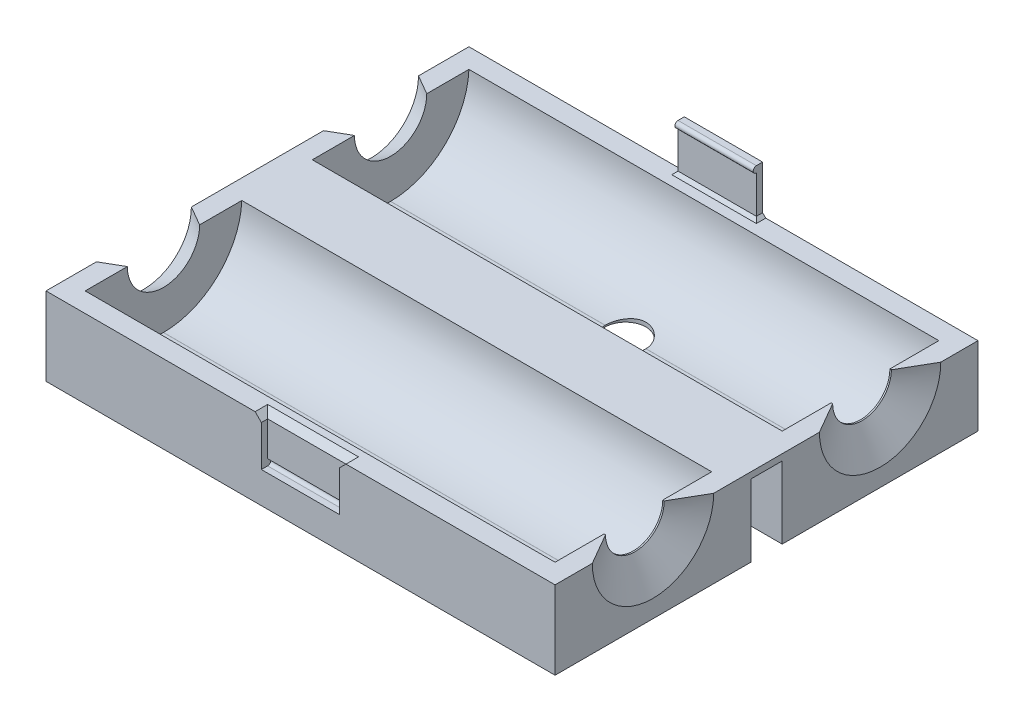
from build123d import *

# Parameters (mm, degrees)
BOSS_EXTRUDE1_DEPTH  = 6.35
BOSS_EXTRUDE2_START  = -6.096
SKETCH1_3_W          = 38.1
SKETCH1_3_H          = 12.7
BOSS_EXTRUDE2_DEPTH  = 1.5875
SKETCH1_5_W          = 41.275
SKETCH1_5_H          = 1.27
BOSS_EXTRUDE4_DEPTH  = 0.508
CHAMFER2_SIZE        = 1.524
SKETCH5_R            = 2.38125
CUT_EXTRUDE1_DEPTH   = 47.505502938
CHAMFER3_SIZE        = 1.466469684
CHAMFER3_SIZE_2      = 2.54
SKETCH6_W            = 6.35
SKETCH6_H            = 0.508
BOSS_EXTRUDE7_DEPTH  = 3.81
BOSS_EXTRUDE10_DEPTH = 6.35
SKETCH6_5_W          = 6.35
SKETCH6_5_H          = 0.508
CUT_EXTRUDE2_DEPTH   = 3.81
CUT_EXTRUDE3_DEPTH   = 6.35
CHAMFER4_SIZE        = 0.508
CHAMFER5_SIZE        = 0.254
SKETCH10_R           = 1.651
CUT_EXTRUDE4_DEPTH   = 46.905317826
CHAMFER6_SIZE        = 2.54
CHAMFER6_SIZE2       = 1.466469684
FILLET1_R            = 6.35


with BuildPart() as part:
    # Sketch1 → Boss-Extrude1 (new body)
    with BuildSketch(Plane(origin=(0, 0, 0), x_dir=(1, 0, 0), z_dir=(0, 1, 0))):
        Polygon((-1.5875, 6.35), (-1.5875, -1.5875), (39.6875, -1.5875), (39.6875, 6.35), (38.1, 6.35), (38.1, 0), (0, 0), (0, 6.35), align=None)
        Polygon((39.6875, -4.1275), (-1.5875, -4.1275), (-1.5875, -12.065), (0, -12.065), (0, -5.715), (38.1, -5.715), (38.1, -12.065), (39.6875, -12.065), align=None)
        Polygon((0, -12.065), (-1.5875, -12.065), (-1.5875, -20.0025), (39.6875, -20.0025), (39.6875, -12.065), (38.1, -12.065), (38.1, -18.415), (0, -18.415), align=None)
        Polygon((-1.5875, 14.2875), (-1.5875, 6.35), (0, 6.35), (0, 12.7), (38.1, 12.7), (38.1, 6.35), (39.6875, 6.35), (39.6875, 14.2875), align=None)
    extrude(amount=-BOSS_EXTRUDE1_DEPTH)

    # Sketch1<3> → Boss-Extrude2 (add)
    with BuildSketch(Plane(origin=(0, 0, 0), x_dir=(1, 0, 0), z_dir=(0, 1, 0)).offset(BOSS_EXTRUDE2_START)):
        with Locations((19.05, -12.065)):
            Rectangle(SKETCH1_3_W, SKETCH1_3_H)
        with Locations((19.05, 6.35)):
            Rectangle(SKETCH1_3_W, SKETCH1_3_H)
    extrude(amount=-BOSS_EXTRUDE2_DEPTH)

    # Sketch1<5> → Boss-Extrude4 (add)
    with BuildSketch(Plane(origin=(0, 0, 0), x_dir=(1, 0, 0), z_dir=(0, 1, 0))):
        with Locations((19.05, -2.2225)):
            Rectangle(SKETCH1_5_W, SKETCH1_5_H)
        with Locations((19.05, -3.4925)):
            Rectangle(SKETCH1_5_W, SKETCH1_5_H)
    extrude(amount=-BOSS_EXTRUDE4_DEPTH)

    # Chamfer2
    # the kernel refuses this chamfer: 1.524 mm, written as the material it adds along each edge
    with BuildSketch(Plane(origin=(38.1, -6.35, 18.415), x_dir=(0, 0, 1), z_dir=(-1, 0, 0))) as chamfer2_piece_1_section:
        Polygon((CHAMFER2_SIZE, 0), (0, -CHAMFER2_SIZE), (0, 0), align=None)
    chamfer2_piece_1 = extrude(amount=38.1, mode=Mode.PRIVATE)
    chamfer2_piece_1 = split(chamfer2_piece_1, bisect_by=Plane(origin=(38.1, -7.6835, 18.415), z_dir=(0, 1, 0)), keep=Keep.TOP, mode=Mode.PRIVATE)
    add(chamfer2_piece_1)
    with BuildSketch(Plane(origin=(0, -6.35, 5.715), x_dir=(-1, 0, 0), z_dir=(0, 0, 1))) as chamfer2_piece_2_section:
        Polygon((CHAMFER2_SIZE, 0), (0, CHAMFER2_SIZE), (0, 0), align=None)
    chamfer2_piece_2 = extrude(amount=12.7, mode=Mode.PRIVATE)
    chamfer2_piece_2 = split(chamfer2_piece_2, bisect_by=Plane(origin=(0, -7.6835, 5.715), z_dir=(0, 1, 0)), keep=Keep.TOP, mode=Mode.PRIVATE)
    add(chamfer2_piece_2)
    with BuildSketch(Plane(origin=(38.1, -6.35, 18.415), x_dir=(1, 0, 0), z_dir=(0, 0, -1))) as chamfer2_piece_3_section:
        Polygon((CHAMFER2_SIZE, 0), (0, CHAMFER2_SIZE), (0, 0), align=None)
    chamfer2_piece_3 = extrude(amount=12.7, mode=Mode.PRIVATE)
    chamfer2_piece_3 = split(chamfer2_piece_3, bisect_by=Plane(origin=(38.1, -7.6835, 18.415), z_dir=(0, 1, 0)), keep=Keep.TOP, mode=Mode.PRIVATE)
    add(chamfer2_piece_3)
    with BuildSketch(Plane(origin=(0, -6.35, 5.715), x_dir=(0, 0, -1), z_dir=(1, 0, 0))) as chamfer2_piece_4_section:
        Polygon((CHAMFER2_SIZE, 0), (0, -CHAMFER2_SIZE), (0, 0), align=None)
    chamfer2_piece_4 = extrude(amount=38.1, mode=Mode.PRIVATE)
    chamfer2_piece_4 = split(chamfer2_piece_4, bisect_by=Plane(origin=(0, -7.6835, 5.715), z_dir=(0, 1, 0)), keep=Keep.TOP, mode=Mode.PRIVATE)
    add(chamfer2_piece_4)
    with BuildSketch(Plane(origin=(38.1, -6.35, 0), x_dir=(0, 0, 1), z_dir=(-1, 0, 0))) as chamfer2_piece_5_section:
        Polygon((CHAMFER2_SIZE, 0), (0, -CHAMFER2_SIZE), (0, 0), align=None)
    chamfer2_piece_5 = extrude(amount=38.1, mode=Mode.PRIVATE)
    chamfer2_piece_5 = split(chamfer2_piece_5, bisect_by=Plane(origin=(38.1, -7.6835, 0), z_dir=(0, 1, 0)), keep=Keep.TOP, mode=Mode.PRIVATE)
    add(chamfer2_piece_5)
    with BuildSketch(Plane(origin=(38.1, -6.35, 0), x_dir=(1, 0, 0), z_dir=(0, 0, -1))) as chamfer2_piece_6_section:
        Polygon((CHAMFER2_SIZE, 0), (0, CHAMFER2_SIZE), (0, 0), align=None)
    chamfer2_piece_6 = extrude(amount=12.7, mode=Mode.PRIVATE)
    chamfer2_piece_6 = split(chamfer2_piece_6, bisect_by=Plane(origin=(38.1, -7.6835, 0), z_dir=(0, 1, 0)), keep=Keep.TOP, mode=Mode.PRIVATE)
    add(chamfer2_piece_6)
    with BuildSketch(Plane(origin=(0, -6.35, -12.7), x_dir=(-1, 0, 0), z_dir=(0, 0, 1))) as chamfer2_piece_7_section:
        Polygon((CHAMFER2_SIZE, 0), (0, CHAMFER2_SIZE), (0, 0), align=None)
    chamfer2_piece_7 = extrude(amount=12.7, mode=Mode.PRIVATE)
    chamfer2_piece_7 = split(chamfer2_piece_7, bisect_by=Plane(origin=(0, -7.6835, -12.7), z_dir=(0, 1, 0)), keep=Keep.TOP, mode=Mode.PRIVATE)
    add(chamfer2_piece_7)
    with BuildSketch(Plane(origin=(0, -6.35, -12.7), x_dir=(0, 0, -1), z_dir=(1, 0, 0))) as chamfer2_piece_8_section:
        Polygon((CHAMFER2_SIZE, 0), (0, -CHAMFER2_SIZE), (0, 0), align=None)
    chamfer2_piece_8 = extrude(amount=38.1, mode=Mode.PRIVATE)
    chamfer2_piece_8 = split(chamfer2_piece_8, bisect_by=Plane(origin=(0, -7.6835, -12.7), z_dir=(0, 1, 0)), keep=Keep.TOP, mode=Mode.PRIVATE)
    add(chamfer2_piece_8)
    with BuildSketch(Plane(origin=(38.1, -6.35, 22.334244874), x_dir=(1, 0, 0), z_dir=(0, 0, -1))) as chamfer2_piece_9a_section:
        Polygon((CHAMFER2_SIZE, 0), (0, CHAMFER2_SIZE), (0, 0), align=None)
    chamfer2_piece_9a = extrude(amount=16.619244874, mode=Mode.PRIVATE)
    chamfer2_piece_9a = split(chamfer2_piece_9a, bisect_by=Plane(origin=(38.1, -6.35, 20.0025), z_dir=(0, 0, -1)), keep=Keep.TOP, mode=Mode.PRIVATE)
    chamfer2_piece_9a = split(chamfer2_piece_9a, bisect_by=Plane(origin=(38.1, -6.35, 18.415), z_dir=(0, 0, 1)), keep=Keep.TOP, mode=Mode.PRIVATE)
    chamfer2_piece_9a = split(chamfer2_piece_9a, bisect_by=Plane(origin=(38.1, -7.6835, 22.334244874), z_dir=(0, 1, 0)), keep=Keep.TOP, mode=Mode.PRIVATE)
    with BuildSketch(Plane(origin=(42.019244874, -6.35, 18.415), x_dir=(0, 0, 1), z_dir=(-1, 0, 0))) as chamfer2_piece_9b_section:
        Polygon((CHAMFER2_SIZE, 0), (0, -CHAMFER2_SIZE), (0, 0), align=None)
    chamfer2_piece_9b = extrude(amount=42.019244874, mode=Mode.PRIVATE)
    chamfer2_piece_9b = split(chamfer2_piece_9b, bisect_by=Plane(origin=(39.6875, -6.35, 18.415), z_dir=(-1, 0, 0)), keep=Keep.TOP, mode=Mode.PRIVATE)
    chamfer2_piece_9b = split(chamfer2_piece_9b, bisect_by=Plane(origin=(42.019244874, -7.6835, 18.415), z_dir=(0, 1, 0)), keep=Keep.TOP, mode=Mode.PRIVATE)
    chamfer2_piece_9b = split(chamfer2_piece_9b, bisect_by=Plane(origin=(38.1, -6.35, 18.415), z_dir=(1, 0, 0)), keep=Keep.TOP, mode=Mode.PRIVATE)
    chamfer2_piece_9 = chamfer2_piece_9a & chamfer2_piece_9b
    add(chamfer2_piece_9)
    with BuildSketch(Plane(origin=(0, -6.35, 5.715), x_dir=(-1, 0, 0), z_dir=(0, 0, 1))) as chamfer2_piece_10a_section:
        Polygon((CHAMFER2_SIZE, 0), (0, CHAMFER2_SIZE), (0, 0), align=None)
    chamfer2_piece_10a = extrude(amount=16.619244874, mode=Mode.PRIVATE)
    chamfer2_piece_10a = split(chamfer2_piece_10a, bisect_by=Plane(origin=(0, -6.35, 20.0025), z_dir=(0, 0, -1)), keep=Keep.TOP, mode=Mode.PRIVATE)
    chamfer2_piece_10a = split(chamfer2_piece_10a, bisect_by=Plane(origin=(0, -6.35, 18.415), z_dir=(0, 0, 1)), keep=Keep.TOP, mode=Mode.PRIVATE)
    chamfer2_piece_10a = split(chamfer2_piece_10a, bisect_by=Plane(origin=(0, -7.6835, 5.715), z_dir=(0, 1, 0)), keep=Keep.TOP, mode=Mode.PRIVATE)
    with BuildSketch(Plane(origin=(38.1, -6.35, 18.415), x_dir=(0, 0, 1), z_dir=(-1, 0, 0))) as chamfer2_piece_10b_section:
        Polygon((CHAMFER2_SIZE, 0), (0, -CHAMFER2_SIZE), (0, 0), align=None)
    chamfer2_piece_10b = extrude(amount=42.019244874, mode=Mode.PRIVATE)
    chamfer2_piece_10b = split(chamfer2_piece_10b, bisect_by=Plane(origin=(-1.5875, -6.35, 18.415), z_dir=(1, 0, 0)), keep=Keep.TOP, mode=Mode.PRIVATE)
    chamfer2_piece_10b = split(chamfer2_piece_10b, bisect_by=Plane(origin=(0, -6.35, 18.415), z_dir=(-1, 0, 0)), keep=Keep.TOP, mode=Mode.PRIVATE)
    chamfer2_piece_10b = split(chamfer2_piece_10b, bisect_by=Plane(origin=(38.1, -7.6835, 18.415), z_dir=(0, 1, 0)), keep=Keep.TOP, mode=Mode.PRIVATE)
    chamfer2_piece_10 = chamfer2_piece_10a & chamfer2_piece_10b
    add(chamfer2_piece_10)
    with BuildSketch(Plane(origin=(0, -6.35, 1.795755126), x_dir=(-1, 0, 0), z_dir=(0, 0, 1))) as chamfer2_piece_11a_section:
        Polygon((CHAMFER2_SIZE, 0), (0, CHAMFER2_SIZE), (0, 0), align=None)
    chamfer2_piece_11a = extrude(amount=16.619244874, mode=Mode.PRIVATE)
    chamfer2_piece_11a = split(chamfer2_piece_11a, bisect_by=Plane(origin=(0, -6.35, 4.1275), z_dir=(0, 0, 1)), keep=Keep.TOP, mode=Mode.PRIVATE)
    chamfer2_piece_11a = split(chamfer2_piece_11a, bisect_by=Plane(origin=(0, -7.6835, 1.795755126), z_dir=(0, 1, 0)), keep=Keep.TOP, mode=Mode.PRIVATE)
    chamfer2_piece_11a = split(chamfer2_piece_11a, bisect_by=Plane(origin=(0, -6.35, 5.715), z_dir=(0, 0, -1)), keep=Keep.TOP, mode=Mode.PRIVATE)
    with BuildSketch(Plane(origin=(-3.919244874, -6.35, 5.715), x_dir=(0, 0, -1), z_dir=(1, 0, 0))) as chamfer2_piece_11b_section:
        Polygon((CHAMFER2_SIZE, 0), (0, -CHAMFER2_SIZE), (0, 0), align=None)
    chamfer2_piece_11b = extrude(amount=42.019244874, mode=Mode.PRIVATE)
    chamfer2_piece_11b = split(chamfer2_piece_11b, bisect_by=Plane(origin=(-1.5875, -6.35, 5.715), z_dir=(1, 0, 0)), keep=Keep.TOP, mode=Mode.PRIVATE)
    chamfer2_piece_11b = split(chamfer2_piece_11b, bisect_by=Plane(origin=(-3.919244874, -7.6835, 5.715), z_dir=(0, 1, 0)), keep=Keep.TOP, mode=Mode.PRIVATE)
    chamfer2_piece_11b = split(chamfer2_piece_11b, bisect_by=Plane(origin=(0, -6.35, 5.715), z_dir=(-1, 0, 0)), keep=Keep.TOP, mode=Mode.PRIVATE)
    chamfer2_piece_11 = chamfer2_piece_11a & chamfer2_piece_11b
    add(chamfer2_piece_11)
    with BuildSketch(Plane(origin=(0, -6.35, 5.715), x_dir=(0, 0, -1), z_dir=(1, 0, 0))) as chamfer2_piece_12a_section:
        Polygon((CHAMFER2_SIZE, 0), (0, -CHAMFER2_SIZE), (0, 0), align=None)
    chamfer2_piece_12a = extrude(amount=42.019244874, mode=Mode.PRIVATE)
    chamfer2_piece_12a = split(chamfer2_piece_12a, bisect_by=Plane(origin=(39.6875, -6.35, 5.715), z_dir=(-1, 0, 0)), keep=Keep.TOP, mode=Mode.PRIVATE)
    chamfer2_piece_12a = split(chamfer2_piece_12a, bisect_by=Plane(origin=(0, -7.6835, 5.715), z_dir=(0, 1, 0)), keep=Keep.TOP, mode=Mode.PRIVATE)
    chamfer2_piece_12a = split(chamfer2_piece_12a, bisect_by=Plane(origin=(38.1, -6.35, 5.715), z_dir=(1, 0, 0)), keep=Keep.TOP, mode=Mode.PRIVATE)
    with BuildSketch(Plane(origin=(38.1, -6.35, 18.415), x_dir=(1, 0, 0), z_dir=(0, 0, -1))) as chamfer2_piece_12b_section:
        Polygon((CHAMFER2_SIZE, 0), (0, CHAMFER2_SIZE), (0, 0), align=None)
    chamfer2_piece_12b = extrude(amount=16.619244874, mode=Mode.PRIVATE)
    chamfer2_piece_12b = split(chamfer2_piece_12b, bisect_by=Plane(origin=(38.1, -6.35, 4.1275), z_dir=(0, 0, 1)), keep=Keep.TOP, mode=Mode.PRIVATE)
    chamfer2_piece_12b = split(chamfer2_piece_12b, bisect_by=Plane(origin=(38.1, -7.6835, 18.415), z_dir=(0, 1, 0)), keep=Keep.TOP, mode=Mode.PRIVATE)
    chamfer2_piece_12b = split(chamfer2_piece_12b, bisect_by=Plane(origin=(38.1, -6.35, 5.715), z_dir=(0, 0, -1)), keep=Keep.TOP, mode=Mode.PRIVATE)
    chamfer2_piece_12 = chamfer2_piece_12a & chamfer2_piece_12b
    add(chamfer2_piece_12)
    with BuildSketch(Plane(origin=(38.1, -6.35, 3.919244874), x_dir=(1, 0, 0), z_dir=(0, 0, -1))) as chamfer2_piece_13a_section:
        Polygon((CHAMFER2_SIZE, 0), (0, CHAMFER2_SIZE), (0, 0), align=None)
    chamfer2_piece_13a = extrude(amount=16.619244874, mode=Mode.PRIVATE)
    chamfer2_piece_13a = split(chamfer2_piece_13a, bisect_by=Plane(origin=(38.1, -6.35, 1.5875), z_dir=(0, 0, -1)), keep=Keep.TOP, mode=Mode.PRIVATE)
    chamfer2_piece_13a = split(chamfer2_piece_13a, bisect_by=Plane(origin=(38.1, -7.6835, 3.919244874), z_dir=(0, 1, 0)), keep=Keep.TOP, mode=Mode.PRIVATE)
    chamfer2_piece_13a = split(chamfer2_piece_13a, bisect_by=Plane(origin=(38.1, -6.35, 0), z_dir=(0, 0, 1)), keep=Keep.TOP, mode=Mode.PRIVATE)
    with BuildSketch(Plane(origin=(42.019244874, -6.35, 0), x_dir=(0, 0, 1), z_dir=(-1, 0, 0))) as chamfer2_piece_13b_section:
        Polygon((CHAMFER2_SIZE, 0), (0, -CHAMFER2_SIZE), (0, 0), align=None)
    chamfer2_piece_13b = extrude(amount=42.019244874, mode=Mode.PRIVATE)
    chamfer2_piece_13b = split(chamfer2_piece_13b, bisect_by=Plane(origin=(39.6875, -6.35, 0), z_dir=(-1, 0, 0)), keep=Keep.TOP, mode=Mode.PRIVATE)
    chamfer2_piece_13b = split(chamfer2_piece_13b, bisect_by=Plane(origin=(42.019244874, -7.6835, 0), z_dir=(0, 1, 0)), keep=Keep.TOP, mode=Mode.PRIVATE)
    chamfer2_piece_13b = split(chamfer2_piece_13b, bisect_by=Plane(origin=(38.1, -6.35, 0), z_dir=(1, 0, 0)), keep=Keep.TOP, mode=Mode.PRIVATE)
    chamfer2_piece_13 = chamfer2_piece_13a & chamfer2_piece_13b
    add(chamfer2_piece_13)
    with BuildSketch(Plane(origin=(38.1, -6.35, 0), x_dir=(0, 0, 1), z_dir=(-1, 0, 0))) as chamfer2_piece_14a_section:
        Polygon((CHAMFER2_SIZE, 0), (0, -CHAMFER2_SIZE), (0, 0), align=None)
    chamfer2_piece_14a = extrude(amount=42.019244874, mode=Mode.PRIVATE)
    chamfer2_piece_14a = split(chamfer2_piece_14a, bisect_by=Plane(origin=(-1.5875, -6.35, 0), z_dir=(1, 0, 0)), keep=Keep.TOP, mode=Mode.PRIVATE)
    chamfer2_piece_14a = split(chamfer2_piece_14a, bisect_by=Plane(origin=(38.1, -7.6835, 0), z_dir=(0, 1, 0)), keep=Keep.TOP, mode=Mode.PRIVATE)
    chamfer2_piece_14a = split(chamfer2_piece_14a, bisect_by=Plane(origin=(0, -6.35, 0), z_dir=(-1, 0, 0)), keep=Keep.TOP, mode=Mode.PRIVATE)
    with BuildSketch(Plane(origin=(0, -6.35, -12.7), x_dir=(-1, 0, 0), z_dir=(0, 0, 1))) as chamfer2_piece_14b_section:
        Polygon((CHAMFER2_SIZE, 0), (0, CHAMFER2_SIZE), (0, 0), align=None)
    chamfer2_piece_14b = extrude(amount=16.619244874, mode=Mode.PRIVATE)
    chamfer2_piece_14b = split(chamfer2_piece_14b, bisect_by=Plane(origin=(0, -6.35, 1.5875), z_dir=(0, 0, -1)), keep=Keep.TOP, mode=Mode.PRIVATE)
    chamfer2_piece_14b = split(chamfer2_piece_14b, bisect_by=Plane(origin=(0, -7.6835, -12.7), z_dir=(0, 1, 0)), keep=Keep.TOP, mode=Mode.PRIVATE)
    chamfer2_piece_14b = split(chamfer2_piece_14b, bisect_by=Plane(origin=(0, -6.35, 0), z_dir=(0, 0, 1)), keep=Keep.TOP, mode=Mode.PRIVATE)
    chamfer2_piece_14 = chamfer2_piece_14a & chamfer2_piece_14b
    add(chamfer2_piece_14)
    with BuildSketch(Plane(origin=(38.1, -6.35, 0), x_dir=(1, 0, 0), z_dir=(0, 0, -1))) as chamfer2_piece_15a_section:
        Polygon((CHAMFER2_SIZE, 0), (0, CHAMFER2_SIZE), (0, 0), align=None)
    chamfer2_piece_15a = extrude(amount=16.619244874, mode=Mode.PRIVATE)
    chamfer2_piece_15a = split(chamfer2_piece_15a, bisect_by=Plane(origin=(38.1, -6.35, -14.2875), z_dir=(0, 0, 1)), keep=Keep.TOP, mode=Mode.PRIVATE)
    chamfer2_piece_15a = split(chamfer2_piece_15a, bisect_by=Plane(origin=(38.1, -6.35, -12.7), z_dir=(0, 0, -1)), keep=Keep.TOP, mode=Mode.PRIVATE)
    chamfer2_piece_15a = split(chamfer2_piece_15a, bisect_by=Plane(origin=(38.1, -7.6835, 0), z_dir=(0, 1, 0)), keep=Keep.TOP, mode=Mode.PRIVATE)
    with BuildSketch(Plane(origin=(0, -6.35, -12.7), x_dir=(0, 0, -1), z_dir=(1, 0, 0))) as chamfer2_piece_15b_section:
        Polygon((CHAMFER2_SIZE, 0), (0, -CHAMFER2_SIZE), (0, 0), align=None)
    chamfer2_piece_15b = extrude(amount=42.019244874, mode=Mode.PRIVATE)
    chamfer2_piece_15b = split(chamfer2_piece_15b, bisect_by=Plane(origin=(39.6875, -6.35, -12.7), z_dir=(-1, 0, 0)), keep=Keep.TOP, mode=Mode.PRIVATE)
    chamfer2_piece_15b = split(chamfer2_piece_15b, bisect_by=Plane(origin=(0, -7.6835, -12.7), z_dir=(0, 1, 0)), keep=Keep.TOP, mode=Mode.PRIVATE)
    chamfer2_piece_15b = split(chamfer2_piece_15b, bisect_by=Plane(origin=(38.1, -6.35, -12.7), z_dir=(1, 0, 0)), keep=Keep.TOP, mode=Mode.PRIVATE)
    chamfer2_piece_15 = chamfer2_piece_15a & chamfer2_piece_15b
    add(chamfer2_piece_15)
    with BuildSketch(Plane(origin=(0, -6.35, -16.619244874), x_dir=(-1, 0, 0), z_dir=(0, 0, 1))) as chamfer2_piece_16a_section:
        Polygon((CHAMFER2_SIZE, 0), (0, CHAMFER2_SIZE), (0, 0), align=None)
    chamfer2_piece_16a = extrude(amount=16.619244874, mode=Mode.PRIVATE)
    chamfer2_piece_16a = split(chamfer2_piece_16a, bisect_by=Plane(origin=(0, -6.35, -14.2875), z_dir=(0, 0, 1)), keep=Keep.TOP, mode=Mode.PRIVATE)
    chamfer2_piece_16a = split(chamfer2_piece_16a, bisect_by=Plane(origin=(0, -6.35, -12.7), z_dir=(0, 0, -1)), keep=Keep.TOP, mode=Mode.PRIVATE)
    chamfer2_piece_16a = split(chamfer2_piece_16a, bisect_by=Plane(origin=(0, -7.6835, -16.619244874), z_dir=(0, 1, 0)), keep=Keep.TOP, mode=Mode.PRIVATE)
    with BuildSketch(Plane(origin=(-3.919244874, -6.35, -12.7), x_dir=(0, 0, -1), z_dir=(1, 0, 0))) as chamfer2_piece_16b_section:
        Polygon((CHAMFER2_SIZE, 0), (0, -CHAMFER2_SIZE), (0, 0), align=None)
    chamfer2_piece_16b = extrude(amount=42.019244874, mode=Mode.PRIVATE)
    chamfer2_piece_16b = split(chamfer2_piece_16b, bisect_by=Plane(origin=(-1.5875, -6.35, -12.7), z_dir=(1, 0, 0)), keep=Keep.TOP, mode=Mode.PRIVATE)
    chamfer2_piece_16b = split(chamfer2_piece_16b, bisect_by=Plane(origin=(0, -6.35, -12.7), z_dir=(-1, 0, 0)), keep=Keep.TOP, mode=Mode.PRIVATE)
    chamfer2_piece_16b = split(chamfer2_piece_16b, bisect_by=Plane(origin=(-3.919244874, -7.6835, -12.7), z_dir=(0, 1, 0)), keep=Keep.TOP, mode=Mode.PRIVATE)
    chamfer2_piece_16 = chamfer2_piece_16a & chamfer2_piece_16b
    add(chamfer2_piece_16)

    # Sketch5 → Cut-Extrude1 (cut, through all)
    with BuildSketch(Plane(origin=(39.6875, 0, 0), x_dir=(0, 0, -1), z_dir=(1, 0, 0))):
        with Locations((-12.065, 0)):
            Circle(SKETCH5_R)
        with Locations((6.35, 0)):
            Circle(SKETCH5_R)
    extrude(amount=-CUT_EXTRUDE1_DEPTH, mode=Mode.SUBTRACT)

    # Chamfer3
    # the kernel refuses this chamfer: 2.54, 1.466469684 mm, written as the material it takes off along each edge
    with BuildSketch(Plane(origin=(-1.5875, 0, 12.065), x_dir=(0, 0.9999950652018582, 0.0031415874858796654), z_dir=(0, 0.0031415874858796654, -0.9999950652018582))) as chamfer3_piece_1:
        Polygon((2.38125 + CHAMFER3_SIZE, 0), (2.38125, CHAMFER3_SIZE_2), (2.38125, 0), align=None)
    revolve(axis=Axis((-1.5875, 0, 12.065), (1, 0, 0)), revolution_arc=359.64, mode=Mode.SUBTRACT)
    with BuildSketch(Plane(origin=(-1.5875, 0, -6.35), x_dir=(0, 0.9999950652018582, 0.0031415874858789195), z_dir=(0, 0.0031415874858789195, -0.9999950652018582))) as chamfer3_piece_2:
        Polygon((2.38125 + CHAMFER3_SIZE, 0), (2.38125, CHAMFER3_SIZE_2), (2.38125, 0), align=None)
    revolve(axis=Axis((-1.5875, 0, -6.35), (1, 0, 0)), revolution_arc=359.64, mode=Mode.SUBTRACT)
    with BuildSketch(Plane(origin=(39.6875, 0, -6.35), x_dir=(0, 0.9999950652018582, 0.0031415874858789195), z_dir=(0, 0.0031415874858789195, -0.9999950652018582))) as chamfer3_piece_3:
        Polygon((2.38125 + CHAMFER3_SIZE_2, 0), (2.38125, -CHAMFER3_SIZE), (2.38125, 0), align=None)
    revolve(axis=Axis((39.6875, 0, -6.35), (1, 0, 0)), revolution_arc=359.64, mode=Mode.SUBTRACT)
    with BuildSketch(Plane(origin=(39.6875, 0, 12.065), x_dir=(0, 0.9999950652018582, 0.0031415874858796654), z_dir=(0, 0.0031415874858796654, -0.9999950652018582))) as chamfer3_piece_4:
        Polygon((2.38125 + CHAMFER3_SIZE_2, 0), (2.38125, -CHAMFER3_SIZE), (2.38125, 0), align=None)
    revolve(axis=Axis((39.6875, 0, 12.065), (1, 0, 0)), revolution_arc=359.64, mode=Mode.SUBTRACT)

    # Sketch6 → Boss-Extrude7 (add)
    with BuildSketch(Plane(origin=(0, 0, 0), x_dir=(1, 0, 0), z_dir=(0, 1, 0))):
        with Locations((19.05, 14.0335)):
            Rectangle(SKETCH6_W, SKETCH6_H)
    extrude(amount=BOSS_EXTRUDE7_DEPTH)

    # Sketch11 → Boss-Extrude10 (add)
    with BuildSketch(Plane(origin=(22.225, 0, 0), x_dir=(0, 0, -1), z_dir=(1, 0, 0))):
        with BuildLine():
            Line((13.7795, 3.81), (13.7795, 3.302))
            ThreePointArc((13.7795, 3.302), (13.5255, 3.556), (13.7795, 3.81))
        make_face()
    extrude(amount=-BOSS_EXTRUDE10_DEPTH)

    # Sketch6<5> → Cut-Extrude2 (cut)
    with BuildSketch(Plane(origin=(0, 0, 0), x_dir=(1, 0, 0), z_dir=(0, 1, 0))):
        with Locations((19.05, -19.7485)):
            Rectangle(SKETCH6_5_W, SKETCH6_5_H)
    extrude(amount=-CUT_EXTRUDE2_DEPTH, mode=Mode.SUBTRACT)

    # Sketch9 → Cut-Extrude3 (cut)
    with BuildSketch(Plane.ZY.offset(-22.225)):
        with BuildLine():
            Line((19.4945, -3.81), (19.4945, -3.302))
            ThreePointArc((19.4945, -3.302), (19.2405, -3.556), (19.4945, -3.81))
        make_face()
    extrude(amount=CUT_EXTRUDE3_DEPTH, mode=Mode.SUBTRACT)

    # Chamfer4
    chamfer4_edges = [part.edges().sort_by_distance(p)[0] for p in [
        (15.875, 0, 19.7485),
        (19.05, 0, 19.4945),
        (22.225, 0, 19.7485),
    ]]
    chamfer(chamfer4_edges, length=CHAMFER4_SIZE)

    # Chamfer5
    chamfer5_edges = [part.edges().sort_by_distance(p)[0] for p in [
        (15.875, 0, -14.0335),
        (19.05, 0, -13.7795),
        (22.225, 0, -14.0335),
    ]]
    chamfer(chamfer5_edges, length=CHAMFER5_SIZE)

    # Sketch10 → Cut-Extrude4 (cut, through all)
    with BuildSketch(Plane.XZ.offset(7.6835)):
        with Locations(Location((19.05, -6.35, 0), (0, 0, 270))):
            Circle(SKETCH10_R)
    extrude(amount=-CUT_EXTRUDE4_DEPTH, mode=Mode.SUBTRACT)

    # Chamfer6
    chamfer6_edges = [part.edges().sort_by_distance(p)[0] for p in [
        (19.05, -7.6835, -4.699),
    ]]
    chamfer6_side = [part.faces().sort_by_distance(p)[0] for p in [
        (0.215935717, -7.6835, -6.35),
    ]]
    chamfer(chamfer6_edges, length=CHAMFER6_SIZE, length2=CHAMFER6_SIZE2, reference=chamfer6_side[0])

    # Fillet1
    # the kernel refuses this fillet: 6.35 mm, written as the material it adds along each edge
    with BuildSketch(Plane(origin=(0, -6.096, 0), x_dir=(0, 0, -1), z_dir=(1, 0, 0))) as fillet1_piece_1_section:
        with BuildLine():
            CenterArc((6.344917966, 6.35), FILLET1_R, 182.292442776, 87.707557224)
            Line((0, 6.096), (0, 0))
            Line((0, 0), (6.344917966, 0))
        make_face()
    fillet1_piece_1 = extrude(amount=38.1, mode=Mode.PRIVATE)
    fillet1_piece_1 = fillet1_piece_1 - Plane(origin=(19.05, -6.096, -6.35), x_dir=(0, 0, -1), z_dir=(0, -1, 0)) * Cylinder(1.651, 102, mode=Mode.PRIVATE)
    add(fillet1_piece_1)
    with BuildSketch(Plane(origin=(38.1, -6.096, -12.7), x_dir=(0, 0, 1), z_dir=(-1, 0, 0))) as fillet1_piece_2_section:
        with BuildLine():
            CenterArc((6.344917966, 6.35), FILLET1_R, 182.292442776, 87.707557224)
            Line((0, 6.096), (0, 0))
            Line((0, 0), (6.344917966, 0))
        make_face()
    fillet1_piece_2 = extrude(amount=38.1, mode=Mode.PRIVATE)
    fillet1_piece_2 = fillet1_piece_2 - Plane(origin=(19.05, -6.096, -6.35), x_dir=(0, 0, -1), z_dir=(0, -1, 0)) * Cylinder(1.651, 102, mode=Mode.PRIVATE)
    add(fillet1_piece_2)
    with BuildSketch(Plane(origin=(0, -6.096, 5.715), x_dir=(0, 1, 0), z_dir=(1, 0, 0)), Plane(origin=(38.1, -6.096, 18.415), x_dir=(0, 1, 0), z_dir=(-1, 0, 0))) as fillet1_piece_3:
        with BuildLine():
            CenterArc((6.35, 6.344917966), FILLET1_R, 180, 87.707557224)
            Line((0, 6.344917966), (0, 0))
            Line((0, 0), (6.096, 0))
        make_face()
    extrude(amount=38.1)


solid = part.part
